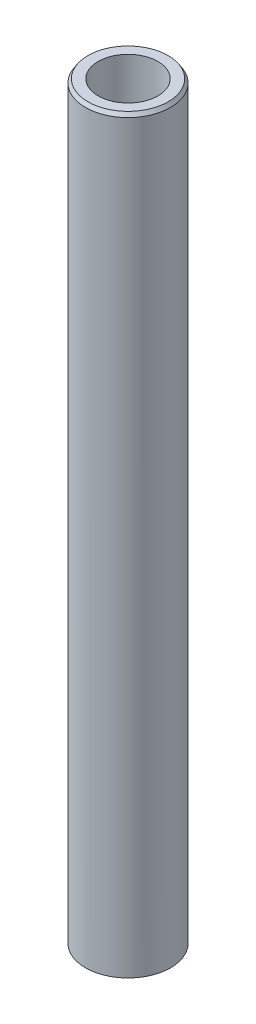
from build123d import *
from OCP.BRepFilletAPI import BRepFilletAPI_MakeChamfer

# Parameters (mm, degrees)
SKETCH1_R           = 25
BOSS_EXTRUDE1_DEPTH = 441.764951989
SKETCH2_R           = 17.562916831
CUT_EXTRUDE1_DEPTH  = 444.177473261
CHAMFER1_SIZE       = 2.17127641
CHAMFER1_SIZE2      = 1.429444863


with BuildPart() as part:
    # Sketch1 → Boss-Extrude1 (new body)
    with BuildSketch(Plane(origin=(0, 0, 0), x_dir=(1, 0, 0), z_dir=(0, 1, 0))):
        Circle(SKETCH1_R)
    extrude(amount=BOSS_EXTRUDE1_DEPTH)

    # Sketch2 → Cut-Extrude1 (cut, through all)
    with BuildSketch(Plane(origin=(0, 0, 0), x_dir=(1, 0, 0), z_dir=(0, 1, 0))):
        Circle(SKETCH2_R)
    extrude(amount=CUT_EXTRUDE1_DEPTH, mode=Mode.SUBTRACT)

    # Chamfer1: one chamfer whose edges measure the first distance from different faces: ONE call of the kernel's chamfer builder (chamfer() names one face for all edges)
    chamfer1_edges_1 = [part.edges().sort_by_distance(p)[0] for p in [
        (-25, 441.764951989, 0),
    ]]
    chamfer1_side_1 = [part.faces().sort_by_distance(p)[0] for p in [
        (-25, 220.882475994, 0),
    ]]
    chamfer1_edges_2 = [part.edges().sort_by_distance(p)[0] for p in [
        (-25, 0, 0),
    ]]
    chamfer1_side_2 = [part.faces().sort_by_distance(p)[0] for p in [
        (-24.292893219, 0, 0),
    ]]
    chamfer1 = BRepFilletAPI_MakeChamfer(part.part.solid().wrapped)
    for e in chamfer1_edges_1:
        chamfer1.Add(CHAMFER1_SIZE, CHAMFER1_SIZE2, e.wrapped, chamfer1_side_1[0].wrapped)  # the first distance lies on this face
    for e in chamfer1_edges_2:
        chamfer1.Add(CHAMFER1_SIZE, CHAMFER1_SIZE2, e.wrapped, chamfer1_side_2[0].wrapped)  # the first distance lies on this face
    add(Compound.cast(chamfer1.Shape()), mode=Mode.REPLACE)


solid = part.part
